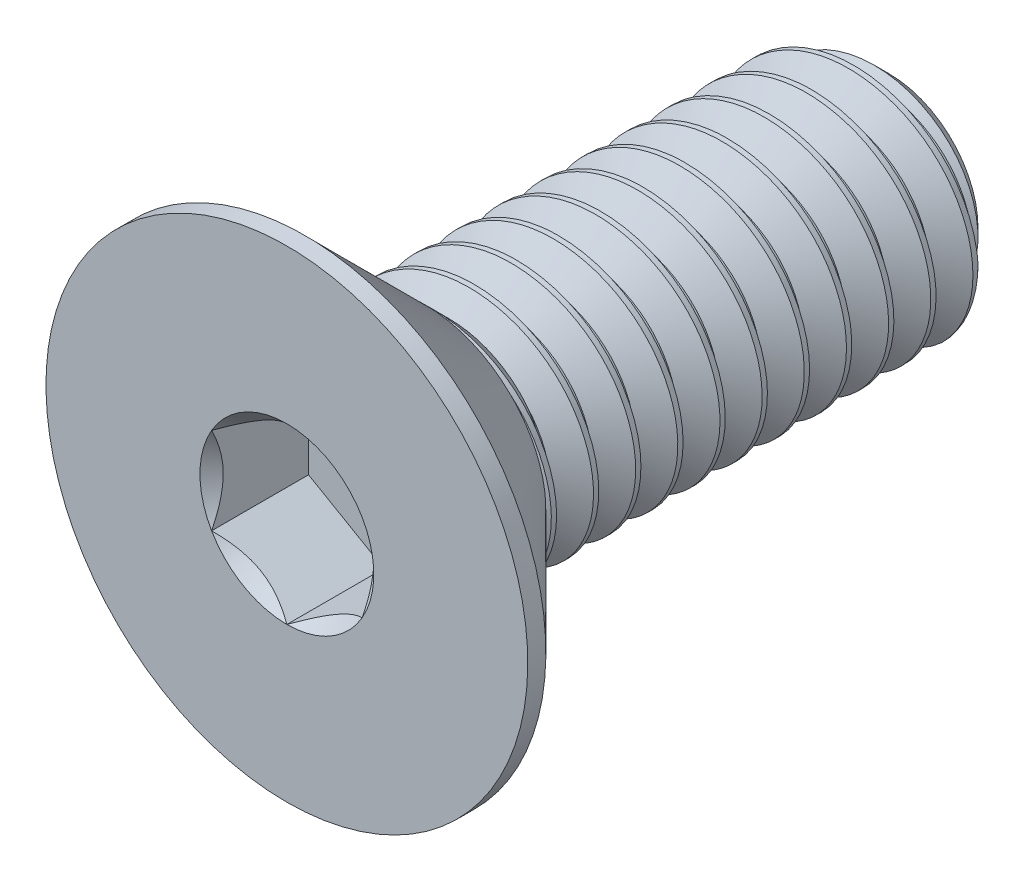
from build123d import *
from build123d.topology import SkipClean

# Parameters (mm, degrees)
SKETCH1_W          = 10
SKETCH1_H          = 2
CHAMFER1_SIZE      = 0.525
CUT_SWEEP1_PITCH   = 0.7
CUT_EXTRUDE2_DEPTH = 1.61


with BuildPart() as part:
    # Sketch1 → Revolve1 (revolve)
    with BuildSketch(Plane(origin=(0, 0, 0), x_dir=(0, 0, -1), z_dir=(1, 0, 0))):
        with Locations((5, 1)):
            Rectangle(SKETCH1_W, SKETCH1_H)
    revolve(axis=Axis((0, 0, -10), (0, 0, 1)))

    # Chamfer1
    chamfer1_edges = [part.edges().sort_by_distance(p)[0] for p in [
        (0, -2, -10),
    ]]
    chamfer(chamfer1_edges, length=CHAMFER1_SIZE)

    # Cut-Sweep1: the profile of Sketch2 profile screwed along a right-hand helix of 14.285714 turns, 6 arcs to a turn; built about Z, then put on its axis
    with SkipClean():  # the faces are left unmerged after this step: merging them gives an invalid solid
        cut_sweep1_z = Axis((0, 0, 0), (0, 0, 1))
        cut_sweep1_corners = [(2.0003, 0, 0.000173205), (2.0003, 0, -0.612673205), (1.545336663, 0, -0.35), (1.545336663, 0, -0.2625)]
        with BuildLine(mode=Mode.PRIVATE) as cut_sweep1_profile:
            Line(cut_sweep1_corners[0], cut_sweep1_corners[1])
            Line(cut_sweep1_corners[1], cut_sweep1_corners[2])
            Line(cut_sweep1_corners[2], cut_sweep1_corners[3])
            Line(cut_sweep1_corners[3], cut_sweep1_corners[0])
        cut_sweep1_cap = Face(cut_sweep1_profile.wire())
        cut_sweep1_turn_angles = [0, 30, 60, 90, 120, 150, 180, 210, 240, 270, 300, 330, 360]
        cut_sweep1_turn_weights = [1, 0.8660254037844387, 1, 0.8660254037844387, 1, 0.8660254037844387, 1, 0.8660254037844387, 1, 0.8660254037844387, 1, 0.8660254037844387, 1]
        cut_sweep1_turn_rails = [Edge.make_bspline([Vector(p[0], p[1], 0).rotate(cut_sweep1_z, cut_sweep1_turn_angles[k]) / cut_sweep1_turn_weights[k] + Vector(0, 0, p[2] + CUT_SWEEP1_PITCH * cut_sweep1_turn_angles[k] / 360) for k in range(13)], [0, 0, 0, 1, 1, 2, 2, 3, 3, 4, 4, 5, 5, 6, 6, 6], 2, cut_sweep1_turn_weights) for p in cut_sweep1_corners]
        cut_sweep1_turn_sides = [Face.make_surface_from_curves(cut_sweep1_turn_rails[p[0]], cut_sweep1_turn_rails[p[1]]) for p in [(0, 1), (1, 2), (2, 3), (3, 0)]]
        cut_sweep1_last_angles = [5040, 5070, 5100, 5121.428571429, 5142.857142857]
        cut_sweep1_last_weights = [1, 0.8660254037844387, 1, 0.9308737486441628, 1]
        cut_sweep1_last_rails = [Edge.make_bspline([Vector(p[0], p[1], 0).rotate(cut_sweep1_z, cut_sweep1_last_angles[k]) / cut_sweep1_last_weights[k] + Vector(0, 0, p[2] + CUT_SWEEP1_PITCH * cut_sweep1_last_angles[k] / 360) for k in range(5)], [0, 0, 0, 1, 1, 2, 2, 2], 2, cut_sweep1_last_weights) for p in cut_sweep1_corners]
        cut_sweep1_last_sides = [Face.make_surface_from_curves(cut_sweep1_last_rails[p[0]], cut_sweep1_last_rails[p[1]]) for p in [(0, 1), (1, 2), (2, 3), (3, 0)]]
        cut_sweep1 = Plane(origin=(0, 0, -10), x_dir=(0, 1, 0), z_dir=(0, 0, 1)) * Solid(Shell([*[p.moved(Location((0, 0, CUT_SWEEP1_PITCH * i))) for i in range(14) for p in cut_sweep1_turn_sides], *cut_sweep1_last_sides, cut_sweep1_cap, cut_sweep1_cap.rotate(cut_sweep1_z, 5142.857142857).moved(Location((0, 0, CUT_SWEEP1_PITCH * 5142.857142857 / 360)))]))
        add(cut_sweep1, mode=Mode.SUBTRACT)

    # Sketch7 → Revolve2 (revolve)
    with BuildSketch(Plane(origin=(0, 0, 0), x_dir=(0, 0, -1), z_dir=(1, 0, 0)), mode=Mode.PRIVATE) as revolve2_sk:
        Polygon((0, 4), (0.3, 4), (2.3, 2), (2.3, 0), (0, 0), align=None)
    revolve(revolve2_sk.sketch.rotate(Axis((0, 0, 0), (0, 0, -1)), 189.336081704), axis=Axis((0, 0, 0), (0, 0, -1)))

    # Boss-Extrude1 cone 1 section (through the dimple's axis) → Boss-Extrude1 (revolve)
    with SkipClean():  # the faces are left unmerged after this step: merging them gives an invalid solid
        with BuildSketch(Plane(origin=(0, 0, -2.3), x_dir=(0, -1, 0), z_dir=(1, 0, 0))):
            Polygon((0, 0), (2, 0), (0, 2), align=None)
        revolve(axis=Axis((0, 0, -2.3), (0, 0, -1)))

    # Sketch5 → Cut-Extrude2 (cut)
    with SkipClean():  # the faces are left unmerged after this step: merging them gives an invalid solid
        with BuildSketch(Plane.XY):
            Polygon((1.25, -0.721687836), (1.25, 0.721687836), (0, 1.443375673), (-1.25, 0.721687836), (-1.25, -0.721687836), (0, -1.443375673), align=None)
        extrude(amount=-CUT_EXTRUDE2_DEPTH, mode=Mode.SUBTRACT)

    # Cut-Extrude3 cone 1 section (through the dimple's axis) → Cut-Extrude3 (revolve, cut)
    with SkipClean():  # the faces are left unmerged after this step: merging them gives an invalid solid
        with BuildSketch(Plane(origin=(0, 0, 0), x_dir=(0, -1, 0), z_dir=(1, 0, 0))):
            Polygon((0, 0), (1.443375673, 0), (0, 1.443375673), align=None)
        revolve(axis=Axis((0, 0, 0), (0, 0, -1)), mode=Mode.SUBTRACT)


solid = part.part
